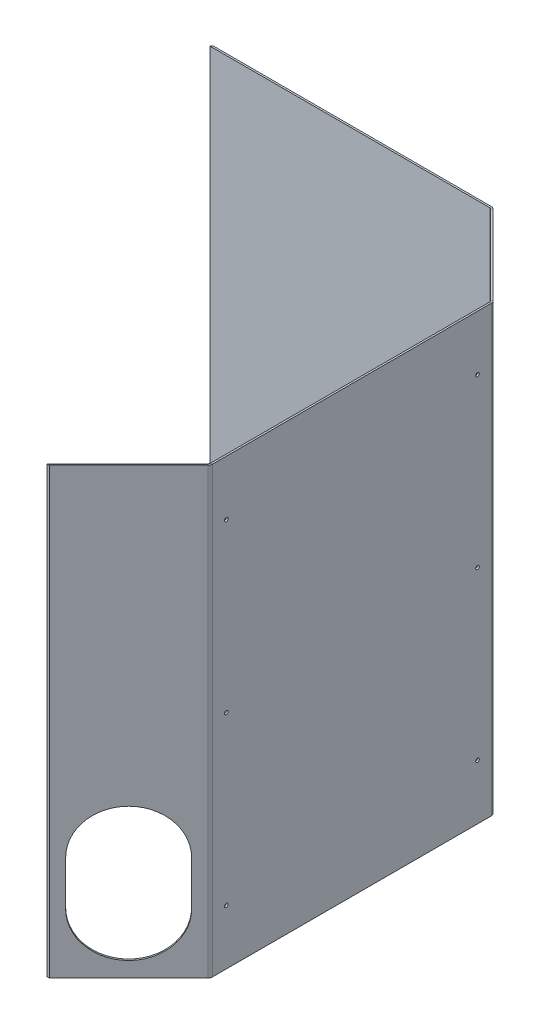
from build123d import *

# Parameters (mm, degrees)
BASE_FLANGE1_DEPTH   = 997
CUT_EXTRUDE1_DEPTH   = 10
SKETCH5_R            = 4
CUT_EXTRUDE2_DEPTH   = 10
CUT_EXTRUDE4_DEPTH   = 10
LPATTERN1_COUNT      = 3
LPATTERN1_PITCH      = 375
LPATTERN1_COUNT_DIR2 = 2
LPATTERN1_PITCH_DIR2 = 564.02
CHAMFER1_SIZE        = 4


# Sheet-metal steps are written as plain solids
with BuildPart() as part:
    # Sketch1 → Base-Flange1 (new body)
    with BuildSketch(Plane(origin=(0, 0, 0), x_dir=(1, 0, 0), z_dir=(0, 1, 0))):
        with BuildLine():
            Line((116.152236891, -603), (297.071067812, -422.08116908))
            ThreePointArc((297.071067812, -422.08116908), (299.238795325, -418.836935591), (300, -415.010101268))
            Line((300, -415.010101268), (300, 211.010101268))
            ThreePointArc((300, 211.010101268), (299.238795325, 214.836935591), (297.071067812, 218.08116908))
            Line((297.071067812, 218.08116908), (119.08116908, 396.071067812))
            ThreePointArc((119.08116908, 396.071067812), (115.836935591, 398.238795325), (112.010101268, 399))
            Line((112.010101268, 399), (-516, 399))
            Line((-516, 399), (-516, 395))
            Line((-516, 395), (112.010101268, 395))
            ThreePointArc((112.010101268, 395), (114.306201862, 394.543277195), (116.252741955, 393.242640687))
            Line((116.252741955, 393.242640687), (294.242640687, 215.252741955))
            ThreePointArc((294.242640687, 215.252741955), (295.543277195, 213.306201862), (296, 211.010101268))
            Line((296, 211.010101268), (296, -415.010101268))
            ThreePointArc((296, -415.010101268), (295.543277195, -417.306201862), (294.242640687, -419.252741955))
            Line((294.242640687, -419.252741955), (113.323809767, -600.171572875))
            Line((113.323809767, -600.171572875), (116.152236891, -603))
        make_face()
    extrude(amount=BASE_FLANGE1_DEPTH)

    # Sketch2 → Cut-Extrude1 (cut)
    with BuildSketch(Plane(origin=(257.576118446, 0, -257.576118446), x_dir=(-0.7071067811865485, 0, -0.7071067811865466), z_dir=(0.7071067811865466, 0, -0.7071067811865485))):
        with BuildLine():
            Line((170.145706961, 234), (170.145706961, 134))
            ThreePointArc((170.145706961, 134), (70.145706961, 34), (-29.854293039, 134))
            Line((-29.854293039, 134), (-29.854293039, 234))
            ThreePointArc((-29.854293039, 234), (70.145706961, 334), (170.145706961, 234))
        make_face()
    extrude(amount=-CUT_EXTRUDE1_DEPTH, mode=Mode.SUBTRACT)

    # Sketch5 → Cut-Extrude2 (cut)
    with BuildSketch(Plane.ZY.offset(-296)):
        with Locations((384.010101268, 873.5)):
            Circle(SKETCH5_R)
    cut_extrude2 = extrude(amount=-CUT_EXTRUDE2_DEPTH, mode=Mode.SUBTRACT)

    # Sketch7 → Cut-Extrude4 (cut)
    with BuildSketch(Plane(origin=(359.576118446, 0, 359.576118446), x_dir=(0.7071067811865416, 0, -0.7071067811865536), z_dir=(0.7071067811865536, 0, 0.7071067811865416))):
        with BuildLine():
            Line((-114.395490323, 234), (-114.395490323, 134))
            ThreePointArc((-114.395490323, 134), (-214.395490323, 34), (-314.395490323, 134))
            Line((-314.395490323, 134), (-314.395490323, 234))
            ThreePointArc((-314.395490323, 234), (-214.395490323, 334), (-114.395490323, 234))
        make_face()
    extrude(amount=-CUT_EXTRUDE4_DEPTH, mode=Mode.SUBTRACT)

    # LPattern1: Cut-Extrude2 3 × 2
    with Locations(*[(0, -i * LPATTERN1_PITCH, -j * LPATTERN1_PITCH_DIR2) for i in range(LPATTERN1_COUNT) for j in range(LPATTERN1_COUNT_DIR2) if (i, j) != (0, 0)]):
        add(cut_extrude2, mode=Mode.SUBTRACT)

    # Chamfer1
    chamfer1_edges = [part.edges().sort_by_distance(p)[0] for p in [
        (116.152236891, 498.5, 603),
        (-516, 498.5, -399),
    ]]
    chamfer(chamfer1_edges, length=CHAMFER1_SIZE - 0.0001)  # a hair under: the kernel refuses the full size


solid = part.part
